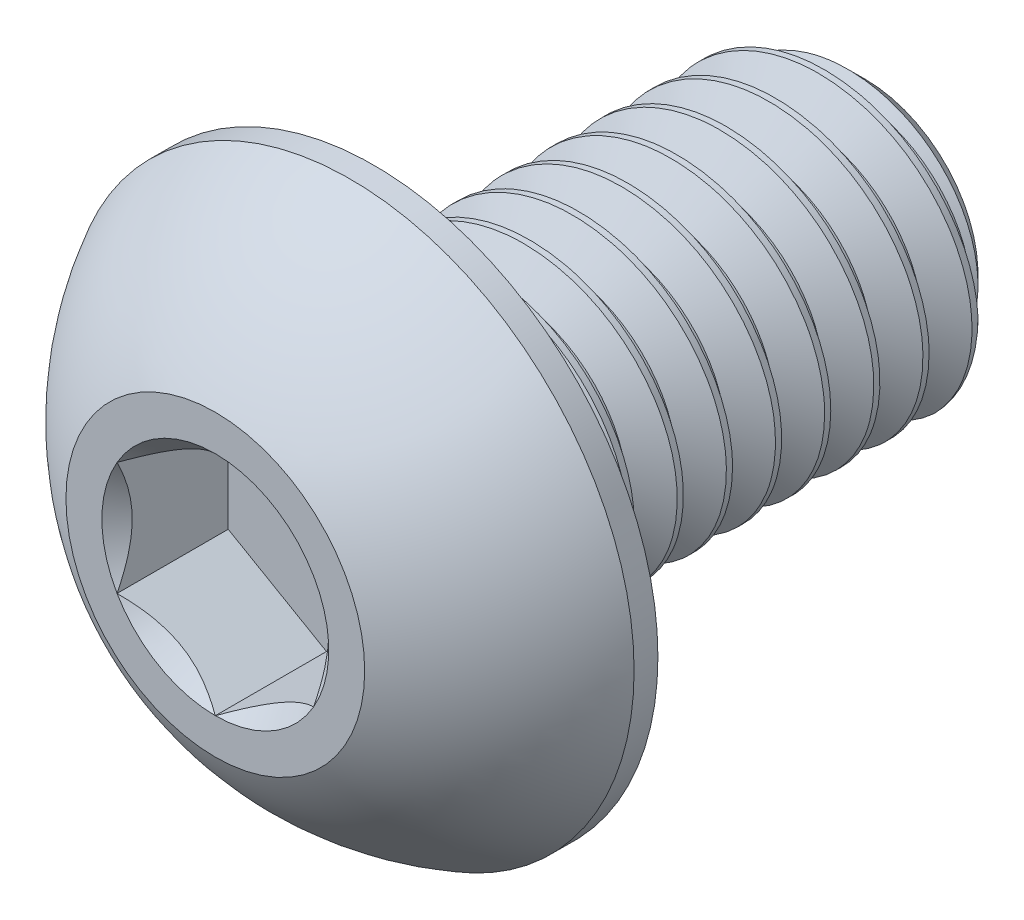
from build123d import *

# Parameters (mm, degrees)
SKETCH1_W          = 7.9375
SKETCH1_H          = 2.413
CHAMFER1_SIZE      = 0.5953125
CUT_SWEEP1_PITCH   = 0.79375
CUT_EXTRUDE2_DEPTH = 1.79578
SKETCH6_R          = 1.833087105
CUT_EXTRUDE3_DEPTH = 1.79578
CUT_EXTRUDE3_TAPER = 45


with BuildPart() as part:
    # Sketch1 → Revolve1 (revolve)
    with BuildSketch(Plane(origin=(0, 0, 0), x_dir=(0, 0, -1), z_dir=(1, 0, 0))):
        with Locations((6.53415, 1.2065)):
            Rectangle(SKETCH1_W, SKETCH1_H)
    revolve(axis=Axis((0, 0, -10.5029), (0, 0, 1)))

    # Chamfer1
    chamfer1_edges = [part.edges().sort_by_distance(p)[0] for p in [
        (0, -2.413, -10.5029),
    ]]
    chamfer(chamfer1_edges, length=CHAMFER1_SIZE)

    # Cut-Sweep1: arcs per turn and ends read off the stored shape
    # Cut-Sweep1: the profile of Sketch2 profile screwed along a right-hand helix through 11 turns, 8 arcs to a turn; built about Z, then put on its axis
    cut_sweep1_z = Axis((0, 0, 0), (0, 0, 1))
    cut_sweep1_corners = [(2.4133, 0, 0.000173205), (2.4133, 0, -0.694704455), (1.897444252, 0, -0.396875), (1.897444252, 0, -0.29765625)]
    with BuildLine(mode=Mode.PRIVATE) as cut_sweep1_profile:
        Line(cut_sweep1_corners[0], cut_sweep1_corners[1])
        Line(cut_sweep1_corners[1], cut_sweep1_corners[2])
        Line(cut_sweep1_corners[2], cut_sweep1_corners[3])
        Line(cut_sweep1_corners[3], cut_sweep1_corners[0])
    cut_sweep1_cap = Face(cut_sweep1_profile.wire())
    cut_sweep1_turn_angles = [0, 22.5, 45, 67.5, 90, 112.5, 135, 157.5, 180, 202.5, 225, 247.5, 270, 292.5, 315, 337.5, 360]
    cut_sweep1_turn_weights = [1, 0.9238795325112867, 1, 0.9238795325112867, 1, 0.9238795325112867, 1, 0.9238795325112867, 1, 0.9238795325112867, 1, 0.9238795325112867, 1, 0.9238795325112867, 1, 0.9238795325112867, 1]
    cut_sweep1_turn_rails = [Edge.make_bspline([Vector(p[0], p[1], 0).rotate(cut_sweep1_z, cut_sweep1_turn_angles[k]) / cut_sweep1_turn_weights[k] + Vector(0, 0, p[2] + CUT_SWEEP1_PITCH * cut_sweep1_turn_angles[k] / 360) for k in range(17)], [0, 0, 0, 1, 1, 2, 2, 3, 3, 4, 4, 5, 5, 6, 6, 7, 7, 8, 8, 8], 2, cut_sweep1_turn_weights) for p in cut_sweep1_corners]
    cut_sweep1_turn_sides = [Face.make_surface_from_curves(cut_sweep1_turn_rails[p[0]], cut_sweep1_turn_rails[p[1]]) for p in [(0, 1), (1, 2), (2, 3), (3, 0)]]
    cut_sweep1 = Plane(origin=(0, 0, -10.5029), x_dir=(0, 1, 0), z_dir=(0, 0, 1)) * Solid(Shell([*[p.moved(Location((0, 0, CUT_SWEEP1_PITCH * i))) for i in range(11) for p in cut_sweep1_turn_sides], cut_sweep1_cap, cut_sweep1_cap.rotate(cut_sweep1_z, 3960).moved(Location((0, 0, CUT_SWEEP1_PITCH * 3960 / 360)))]))
    add(cut_sweep1, mode=Mode.SUBTRACT)

    # Sketch7 → Revolve2 (revolve)
    with BuildSketch(Plane(origin=(0, 0, 0), x_dir=(0, 0, -1), z_dir=(1, 0, 0)), mode=Mode.PRIVATE) as revolve2_sk:
        with BuildLine():
            Line((2.18059, 4.5847), (2.5654, 4.5847))
            Line((2.5654, 4.5847), (2.5654, 0))
            Line((2.5654, 0), (0, 0))
            Line((0, 0), (0, 2.413))
            ThreePointArc((0, 2.413), (0.925030326, 3.664791196), (2.18059, 4.5847))
        make_face()
    revolve(revolve2_sk.sketch.rotate(Axis((0, 0, 0), (0, 0, -1)), 189.052465709), axis=Axis((0, 0, 0), (0, 0, -1)))

    # Sketch5 → Cut-Extrude2 (cut)
    with BuildSketch(Plane.XY):
        Polygon((1.5875, -0.916543552), (1.5875, 0.916543552), (0, 1.833087105), (-1.5875, 0.916543552), (-1.5875, -0.916543552), (0, -1.833087105), align=None)
    extrude(amount=-CUT_EXTRUDE2_DEPTH, mode=Mode.SUBTRACT)

    # Sketch6 → Cut-Extrude3 (cut)
    with BuildSketch(Plane.XY):
        Circle(SKETCH6_R)
    extrude(amount=-CUT_EXTRUDE3_DEPTH, taper=CUT_EXTRUDE3_TAPER, mode=Mode.SUBTRACT)


solid = part.part
